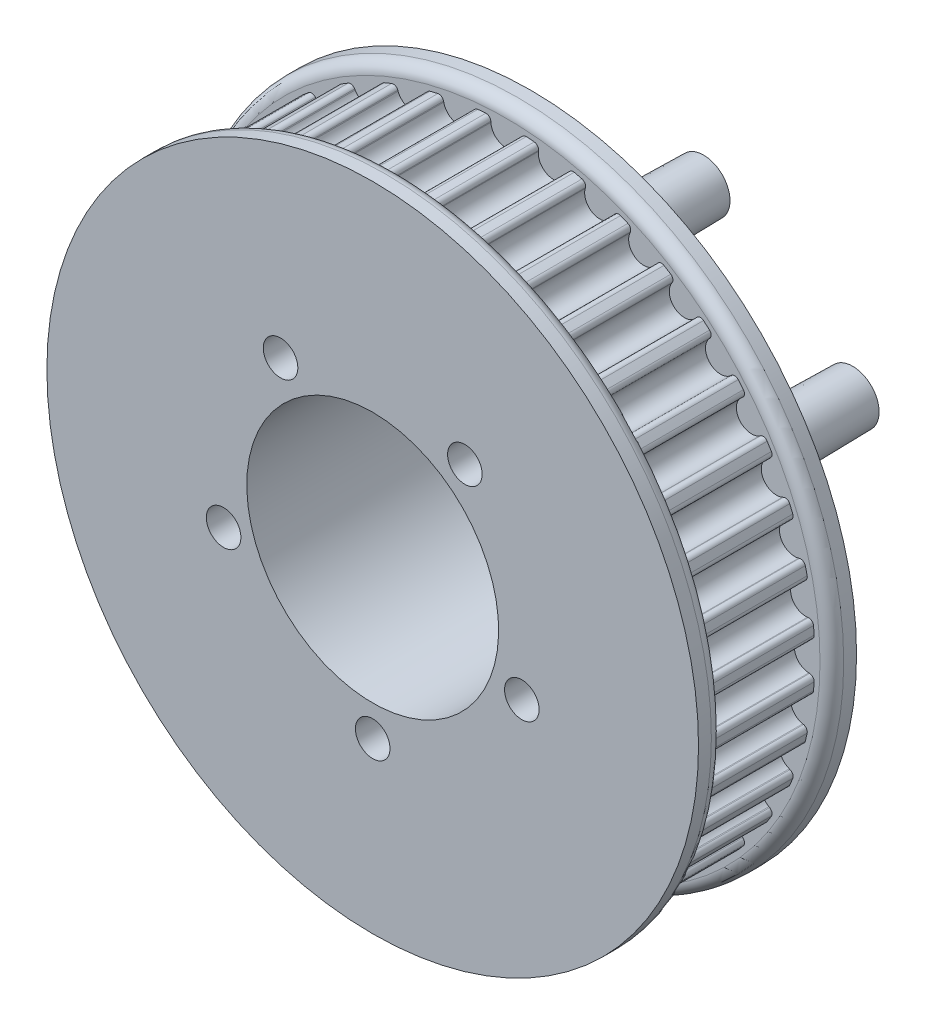
from build123d import *

# Parameters (mm, degrees)
SKETCH_3_R                       = 31.259488618379066
EXTRUDE_2_DEPTH                  = 11
CUT_EXTRUDE_2_DEPTH              = 46.555584261044665
FILLET_1_R                       = 0.48
PATTERN_CIRCULAR_1_COUNT         = 40
FILLET_1_OF_PATTERN_CIRCULAR_1_R = 0.48
SKETCH_8_R                       = 32.98948861837907
EXTRUDE_3_DEPTH                  = 2.5
EXTRUDE_START                    = 2.5
SKETCH_9_R                       = 32.98948861837907
EXTRUDE_4_DEPTH                  = 2.5
SKETCH_10_R                      = 2.675
SKETCH_10_R_2                    = 2.674999999999999
SKETCH_10_R_3                    = 2.6750000000000007
EXTRUDE_5_DEPTH                  = 20
M5X0_8_2_D                       = 3.5
DRAFT_1_ANGLE                    = 1.0000000000000022
SKETCH_4_R                       = 12.75
CUT_EXTRUDE_3_DEPTH              = 55.493985640999895
FILLET_2_R                       = 1.2


with BuildPart() as part:
    # 스케치3 → 보스-돌출2 (new body)
    with BuildSketch(Plane.XY):
        Circle(SKETCH_3_R)
    extrude(amount=EXTRUDE_2_DEPTH)

    # 스케치3<3> → 컷-돌출2 (cut, symmetric)
    with BuildSketch(Plane.XY):
        with BuildLine():
            Line((-1.5617286792044034, 31.220452146231334), (-1.5330831105243496, 30.647799791129046))
            ThreePointArc((-1.5330831105243503, 30.647799791129046), (-2.8e-16, 29.189488618379063), (1.53308311052435, 30.647799791129046))
            Line((1.5330831105243496, 30.647799791129046), (1.5617286792044034, 31.220452146231334))
            ThreePointArc((1.5617286792044034, 31.220452146231334), (-2.2e-16, 31.259488618379066), (-1.5617286792044032, 31.220452146231338))
        make_face()
    cut_extrude_2 = extrude(amount=CUT_EXTRUDE_2_DEPTH, both=True, mode=Mode.SUBTRACT)

    # 필렛1
    fillet_1_edges = [part.edges().sort_by_distance(p)[0] for p in [
        (1.5617286792044034, 31.220452146231338, 5.5),
        (-1.5617286792044036, 31.220452146231338, 5.5),
    ]]
    fillet(fillet_1_edges, radius=FILLET_1_R)

    # 원형 패턴1: 컷-돌출2 ×40 about axis
    pattern_circular_1_axis = Axis((0, 0, 11), (0, 0, -1))
    for i in range(1, PATTERN_CIRCULAR_1_COUNT):
        add(cut_extrude_2.rotate(pattern_circular_1_axis, i * 360 / PATTERN_CIRCULAR_1_COUNT), mode=Mode.SUBTRACT)

    # 필렛1 of 원형 패턴1
    fillet_1_of_pattern_circular_1_edges = [part.edges().sort_by_distance(p)[0] for p in [
        (6.42645593743306, 30.591768382471813, 5.5),
        (3.341453522186593, 31.080384763410464, 5.5),
        (11.132942522297654, 29.209813752877423, 5.5),
        (8.162358048212912, 30.175015157831226, 5.5),
        (15.565299114145375, 27.108616566873266, 5.5),
        (12.782278229778964, 28.526636533932447, 5.5),
        (19.614386383536775, 24.3399152726524, 5.5),
        (17.087456299378566, 26.175837444089506, 5.5),
        (23.180502363749223, 20.97188448487134, 5.5),
        (20.971884484871335, 23.180502363749227, 5.5),
        (26.175837444089506, 17.087456299378566, 5.5),
        (24.3399152726524, 19.614386383536775, 5.5),
        (28.526636533932443, 12.782278229778965, 5.5),
        (27.108616566873263, 15.565299114145377, 5.5),
        (30.175015157831226, 8.162358048212914, 5.5),
        (29.209813752877423, 11.132942522297656, 5.5),
        (31.080384763410464, 3.3414535221865953, 5.5),
        (30.591768382471813, 6.4264559374330625, 5.5),
        (31.220452146231338, -1.5617286792044014, 5.5),
        (31.220452146231338, 1.5617286792044056, 5.5),
        (30.591768382471813, -6.426455937433058, 5.500000000000001),
        (31.080384763410464, -3.3414535221865913, 5.500000000000001),
        (29.209813752877427, -11.132942522297652, 5.5),
        (30.17501515783123, -8.16235804821291, 5.5),
        (27.108616566873266, -15.565299114145374, 5.5),
        (28.526636533932447, -12.782278229778962, 5.5),
        (24.3399152726524, -19.614386383536768, 5.500000000000001),
        (26.175837444089506, -17.087456299378562, 5.500000000000001),
        (20.97188448487134, -23.180502363749223, 5.5),
        (23.180502363749227, -20.971884484871335, 5.5),
        (17.087456299378573, -26.175837444089503, 5.5),
        (19.614386383536775, -24.339915272652398, 5.5),
        (12.782278229778967, -28.526636533932443, 5.5),
        (15.565299114145379, -27.108616566873263, 5.5),
        (8.162358048212916, -30.175015157831226, 5.5),
        (11.132942522297657, -29.209813752877423, 5.5),
        (3.3414535221865975, -31.08038476341046, 5.5),
        (6.426455937433063, -30.59176838247181, 5.5),
        (-1.5617286792043996, -31.220452146231338, 5.5),
        (1.5617286792044074, -31.220452146231338, 5.5),
        (-6.426455937433056, -30.591768382471813, 5.5),
        (-3.3414535221865886, -31.080384763410464, 5.5),
        (-11.13294252229765, -29.209813752877427, 5.5),
        (-8.162358048212909, -30.17501515783123, 5.5),
        (-15.565299114145374, -27.108616566873266, 5.500000000000001),
        (-12.782278229778962, -28.526636533932447, 5.500000000000001),
        (-19.61438638353677, -24.339915272652405, 5.500000000000001),
        (-17.087456299378562, -26.17583744408951, 5.500000000000001),
        (-23.180502363749223, -20.971884484871342, 5.5),
        (-20.971884484871335, -23.18050236374923, 5.5),
        (-26.175837444089503, -17.087456299378573, 5.5),
        (-24.339915272652398, -19.614386383536775, 5.5),
        (-28.526636533932443, -12.782278229778969, 5.5),
        (-27.108616566873263, -15.56529911414538, 5.5),
        (-30.175015157831226, -8.162358048212917, 5.500000000000001),
        (-29.209813752877423, -11.13294252229766, 5.500000000000001),
        (-31.08038476341046, -3.3414535221865993, 5.500000000000001),
        (-30.59176838247181, -6.426455937433065, 5.500000000000001),
        (-31.220452146231338, 1.5617286792043976, 5.5),
        (-31.220452146231338, -1.5617286792044094, 5.5),
        (-30.591768382471813, 6.4264559374330545, 5.5),
        (-31.080384763410464, 3.341453522186587, 5.5),
        (-29.209813752877427, 11.132942522297649, 5.5),
        (-30.17501515783123, 8.162358048212907, 5.5),
        (-27.10861656687327, 15.565299114145372, 5.5),
        (-28.52663653393245, 12.78227822977896, 5.5),
        (-24.339915272652405, 19.614386383536768, 5.5),
        (-26.17583744408951, 17.08745629937856, 5.5),
        (-20.971884484871342, 23.18050236374922, 5.5),
        (-23.18050236374923, 20.97188448487133, 5.5),
        (-17.087456299378577, 26.175837444089503, 5.5),
        (-19.614386383536782, 24.339915272652398, 5.5),
        (-12.78227822977897, 28.526636533932443, 5.5),
        (-15.565299114145382, 27.108616566873263, 5.5),
        (-8.16235804821292, 30.175015157831226, 5.5),
        (-11.132942522297661, 29.209813752877423, 5.5),
        (-3.341453522186602, 31.08038476341046, 5.5),
        (-6.426455937433069, 30.59176838247181, 5.5),
    ]]
    fillet(fillet_1_of_pattern_circular_1_edges, radius=FILLET_1_OF_PATTERN_CIRCULAR_1_R)

    # 스케치8 → 보스-돌출3 (add)
    with BuildSketch(Plane.XY.offset(11)):
        Circle(SKETCH_8_R)
    extrude(amount=EXTRUDE_3_DEPTH)

    # 스케치9 → 보스-돌출4 (add)
    with BuildSketch(Plane(origin=(0, 0, 0), x_dir=(-1, 0, 0), z_dir=(0, 0, -1)).offset(EXTRUDE_START)):
        Circle(SKETCH_9_R)
    extrude(amount=-EXTRUDE_4_DEPTH)

    # 스케치7 → 회전2 (revolve)
    with BuildSketch(Plane.ZY):
        with BuildLine():
            Line((-14.659931583815899, 11), (-14.659931583815899, 0))
            Line((-14.659931583815899, 0), (-1.004808498528325, 0))
            Line((-1.0048084985283248, 0), (-1.0048084985283245, 27.097837622782833))
            Line((-1.004808498528325, 27.097837622782833), (-4.8999999999999995, 29.34672748470262))
            ThreePointArc((-4.899999999999993, 29.34672748470262), (-6.4092638367154375, 25.81060883673544), (-7.254808498528332, 22.06))
            ThreePointArc((-7.2548084985283285, 22.06), (-12.637719623884406, 17.655062883028585), (-14.659931583815899, 11))
        make_face()
    revolve(axis=Axis((0, 0, -14.659931583815899), (0, 0, 1)))

    # 스케치10 → 보스-돌출5 (add)
    with BuildSketch(Plane.XY):
        with Locations((0, 15.875)):
            Circle(SKETCH_10_R)
        with Locations((15.098022196185564, 4.905644785702292)):
            Circle(SKETCH_10_R_2)
        with Locations((9.331090880143012, -12.84314478570229)):
            Circle(SKETCH_10_R_3)
        with Locations((-9.33109088014301, -12.843144785702291)):
            Circle(SKETCH_10_R_3)
        with Locations((-15.098022196185564, 4.905644785702288)):
            Circle(SKETCH_10_R_3)
    extrude(amount=-EXTRUDE_5_DEPTH)

    # M5x0.8 탭을 위한 탭 드릴2 (through all)
    with Locations(Plane(origin=(0, 0, 13.5), x_dir=(-1, 0, 0), z_dir=(0, 0, 1))):
        with Locations((-15.098022196, 4.905644786), (0, 15.875), (15.098022196, 4.905644786), (9.33109088, -12.843144786), (-9.33109088, -12.843144786)):
            Hole(M5X0_8_2_D / 2)

    # 구배1
    draft_1_faces = [part.faces().sort_by_distance(p)[0] for p in [
        (12.423022196185565, 4.905644785702292, -15.987966488440785),
        (6.656090880143012, -12.843144785702288, -15.98788555870242),
        (-12.006090880143011, -12.843144785702291, -15.988005003869372),
        (-17.773022196185565, 4.905644785702288, -15.987938251707364),
        (-2.675, 15.875, -15.988111301279222),
    ]]
    draft(draft_1_faces, Plane(origin=(0, 15.875, -20), x_dir=(-1, 0, 0), z_dir=(0, 0, -1)), DRAFT_1_ANGLE)

    # 스케치4 → 컷-돌출3 (cut, through all)
    with BuildSketch(Plane(origin=(0, 0, -14.659931583815899), x_dir=(-1, 0, 0), z_dir=(0, 0, -1))):
        Circle(SKETCH_4_R)
    extrude(amount=-CUT_EXTRUDE_3_DEPTH, mode=Mode.SUBTRACT)

    # 필렛2
    fillet_2_edges = [part.edges().sort_by_distance(p)[0] for p in [
        (-32.98948861837907, 4.04e-15, 11),
        (32.98948861837907, 4.04e-15, 0),
    ]]
    fillet(fillet_2_edges, radius=FILLET_2_R)


solid = part.part
